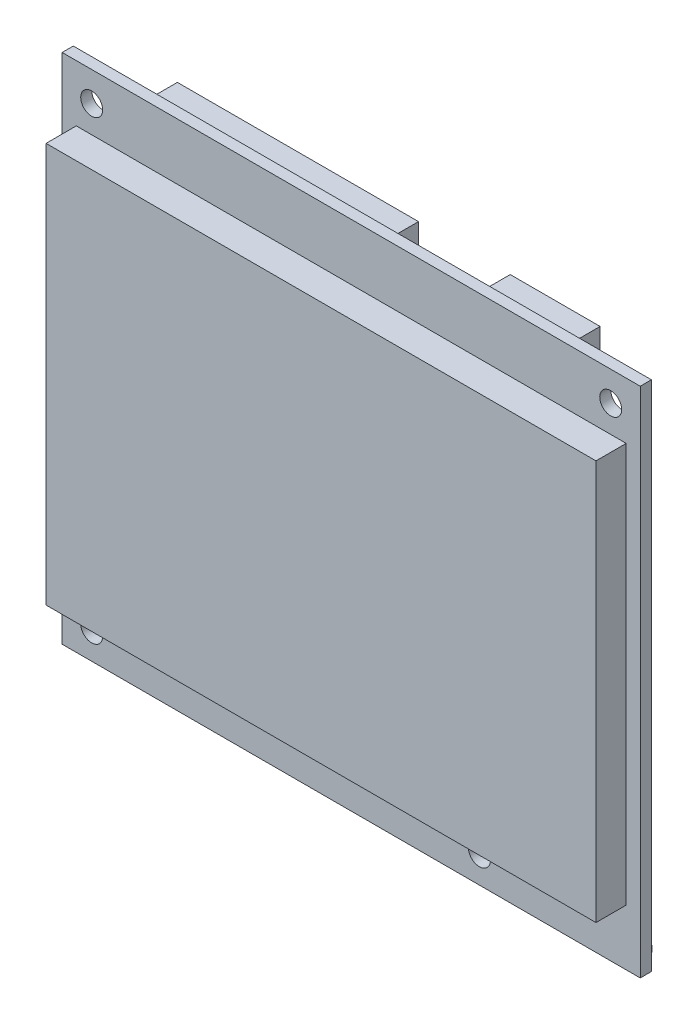
from build123d import *

# Parameters (mm, degrees)
SKETCH1_W           = 81.6864
SKETCH1_H           = 72.4154
BOSS_EXTRUDE1_DEPTH = 1.5748
SKETCH2_W           = 77.7
SKETCH2_H           = 56.5
BOSS_EXTRUDE2_DEPTH = 4.27
SKETCH4_R           = 1.55
CUT_EXTRUDE1_DEPTH  = 58.189442313
SKETCH3_W           = 12.7
SKETCH3_H           = 5.08
SKETCH3_W_2         = 34.071115987
BOSS_EXTRUDE3_DEPTH = 5.08
SKETCH5_W           = 11.143297124
SKETCH5_H           = 14.820585176
SKETCH5_W_2         = 5.702652661
SKETCH5_H_2         = 0.935331402
BOSS_EXTRUDE4_DEPTH = 1


with BuildPart() as part:
    # Sketch1 → Boss-Extrude1 (new body)
    with BuildSketch(Plane(origin=(0, 0, 0), x_dir=(-1, 0, 0), z_dir=(0, 0, -1))):
        with Locations((2.8568, -0.2173)):
            Rectangle(SKETCH1_W, SKETCH1_H)
    extrude(amount=BOSS_EXTRUDE1_DEPTH)

    # Sketch2 → Boss-Extrude2 (add)
    with BuildSketch(Plane(origin=(0, 0, 0), x_dir=(-1, 0, 0), z_dir=(0, 0, -1))):
        with Locations((2.85, -0.25)):
            Rectangle(SKETCH2_W, SKETCH2_H)
    extrude(amount=-BOSS_EXTRUDE2_DEPTH)

    # Sketch4 → Cut-Extrude1 (cut, through all)
    with BuildSketch(Plane(origin=(0, 0, -1.5748), x_dir=(-1, 0, 0), z_dir=(0, 0, -1))):
        with Locations((39.525, 31.8154)):
            Circle(SKETCH4_R)
        with Locations((39.525, -32.625)):
            Circle(SKETCH4_R)
        with Locations((-15.2614, -32.625)):
            Circle(SKETCH4_R)
        with Locations((-33.8114, 31.8154)):
            Circle(SKETCH4_R)
    extrude(amount=-CUT_EXTRUDE1_DEPTH, mode=Mode.SUBTRACT)

    # Sketch3 → Boss-Extrude3 (add)
    with BuildSketch(Plane.XY.offset(-1.5748)):
        with Locations((19.31004682, 31.274104804)):
            Rectangle(SKETCH3_W, SKETCH3_H)
        with Locations((-17.035557993, 31.274104804)):
            Rectangle(SKETCH3_W_2, SKETCH3_H)
        with Locations((-17.035557993, -31.699250815)):
            Rectangle(SKETCH3_W_2, SKETCH3_H)
    extrude(amount=-BOSS_EXTRUDE3_DEPTH)

    # Sketch5 → Boss-Extrude4 (add)
    with BuildSketch(Plane(origin=(0, 0, -1.5748), x_dir=(-1, 0, 0), z_dir=(0, 0, -1))):
        Polygon((19.476551601, 13.535617464), (30.731281697, 2.280887368), (19.476551601, -8.973842728), (8.221821505, 2.280887368), align=None)
        with Locations((-21.419348846, -17.387032057)):
            Rectangle(SKETCH5_W, SKETCH5_H)
        with Locations((-34.20974354, -34.592993391)):
            Rectangle(SKETCH5_W_2, SKETCH5_H_2)
    extrude(amount=BOSS_EXTRUDE4_DEPTH)


solid = part.part
